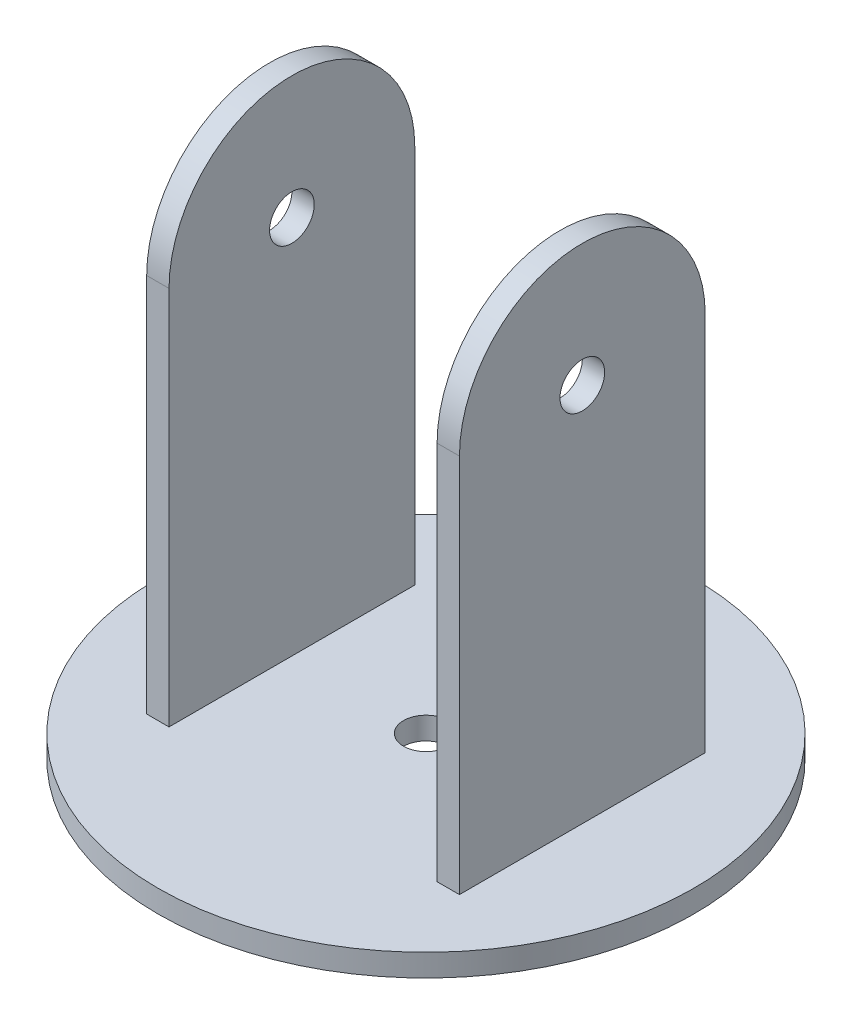
from build123d import *

# Parameters (mm, degrees)
SKETCH2_R           = 60
BOSS_EXTRUDE2_DEPTH = 5
BOSS_EXTRUDE3_DEPTH = 5
SKETCH4_R           = 5
CUT_EXTRUDE1_DEPTH  = 163.576904879
SKETCH5_R           = 5
CUT_EXTRUDE2_DEPTH  = 5


with BuildPart() as part:
    # Sketch2 → Boss-Extrude2 (new body)
    with BuildSketch(Plane(origin=(0, 0, 0), x_dir=(1, 0, 0), z_dir=(0, 1, 0))):
        Circle(SKETCH2_R)
    extrude(amount=BOSS_EXTRUDE2_DEPTH)

    # Sketch3 → Boss-Extrude3 (add)
    with BuildSketch(Plane(origin=(35, 0, 0), x_dir=(0, 0, -1), z_dir=(1, 0, 0))):
        with BuildLine():
            Line((-27.5, 0), (27.5, 0))
            Line((27.5, 0), (27.5, 90))
            ThreePointArc((27.5, 90), (0, 117.5), (-27.5, 90))
            Line((-27.5, 90), (-27.5, 0))
        make_face()
    boss_extrude3 = extrude(amount=-BOSS_EXTRUDE3_DEPTH)

    # Mirror1: Boss-Extrude3 across plane
    add(boss_extrude3.mirror(Plane(origin=(0, 0, 0), x_dir=(0, 0, 1), z_dir=(1, 0, 0))))

    # Sketch4 → Cut-Extrude1 (cut, through all)
    with BuildSketch(Plane(origin=(35, 0, 0), x_dir=(0, 0, -1), z_dir=(1, 0, 0))):
        with Locations((0, 90)):
            Circle(SKETCH4_R)
    extrude(amount=-CUT_EXTRUDE1_DEPTH, mode=Mode.SUBTRACT)

    # Sketch5 → Cut-Extrude2 (cut)
    with BuildSketch(Plane(origin=(0, 5, 0), x_dir=(1, 0, 0), z_dir=(0, 1, 0))):
        Circle(SKETCH5_R)
    extrude(amount=-CUT_EXTRUDE2_DEPTH, mode=Mode.SUBTRACT)


solid = part.part
